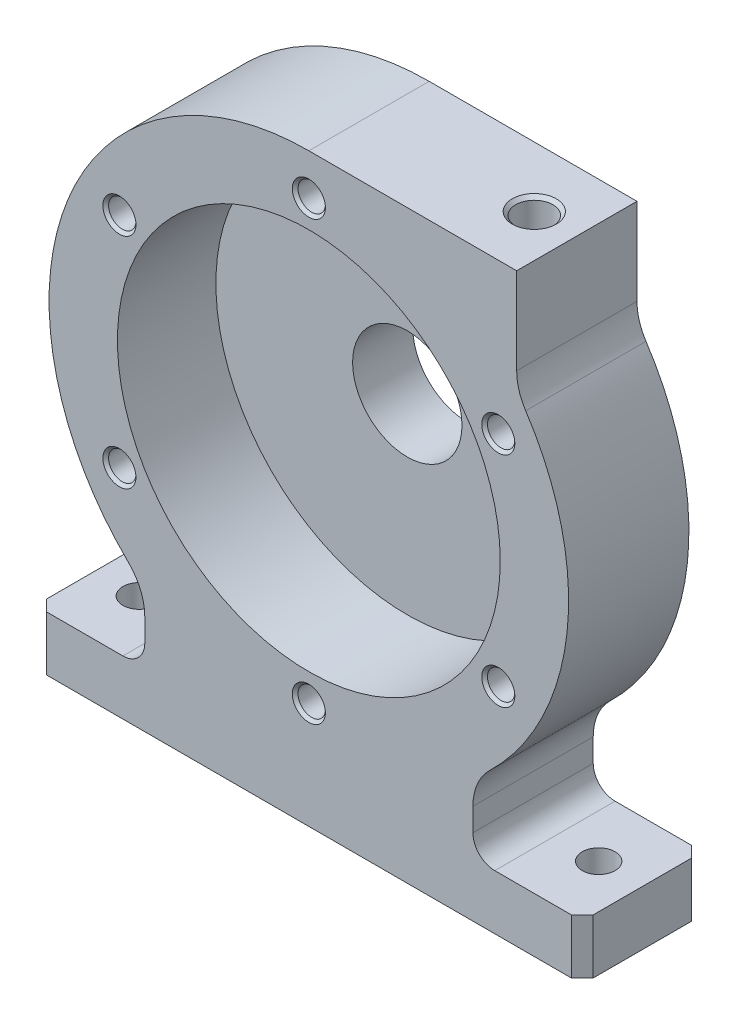
from build123d import *

# Parameters (mm, degrees)
BOSS_EXTRUDE1_DEPTH                                 = 22
SKETCH2_R                                           = 35
CUT_EXTRUDE1_DEPTH                                  = 18
SKETCH3_R                                           = 14
BOSS_EXTRUDE2_DEPTH                                 = 7
FILLET1_R                                           = 4
SKETCH4_R                                           = 10
CUT_EXTRUDE2_DEPTH                                  = 83.953300115
CHAMFER1_SIZE                                       = 2
M8X1_25_TAPPED_HOLE1_D                              = 6.8
M8X1_25_TAPPED_HOLE1_DEPTH                          = 29.75
M8X1_25_TAPPED_HOLE1_CSINK_D                        = 8.05
M8X1_25_TAPPED_HOLE1_CSINK_ANGLE                    = 90
M8X1_25_TAPPED_HOLE1_TIP                            = 2.042926105
CIRPATTERN1_COUNT                                   = 6
CSK_FOR_M8_COUNTERSUNK_FLAT_HEAD_SCREW1_D           = 6
CSK_FOR_M8_COUNTERSUNK_FLAT_HEAD_SCREW1_DEPTH       = 20
CSK_FOR_M8_COUNTERSUNK_FLAT_HEAD_SCREW1_CSINK_D     = 8
CSK_FOR_M8_COUNTERSUNK_FLAT_HEAD_SCREW1_CSINK_ANGLE = 90
CSK_FOR_M8_COUNTERSUNK_FLAT_HEAD_SCREW1_TIP         = 1.802581857


with BuildPart() as part:
    # Sketch1 → Boss-Extrude1 (new body)
    with BuildSketch(Plane.XY):
        with BuildLine():
            Line((-50, -59.5), (50, -59.5))
            Line((50, -59.5), (50, -49.5))
            Line((50, -49.5), (34, -49.5))
            ThreePointArc((34, -49.5), (31.171572875, -48.328427125), (30, -45.5))
            Line((30, -45.5), (30, -41.306779105))
            ThreePointArc((30, -41.306779105), (30.792252789, -37.405831617), (33.043478261, -34.122991434))
            ThreePointArc((33.043478261, -34.122991434), (47.217043986, -5.176944775), (39.652173913, 26.152535326))
            ThreePointArc((39.652173913, 26.152535326), (38.421945373, 28.784159388), (38, 31.658332237))
            Line((38, 31.658332237), (38, 47.5))
            Line((38, 47.5), (0, 47.5))
            ThreePointArc((0, 47.5), (-44.028922841, 17.824251834), (-33.043478261, -34.122991434))
            ThreePointArc((-33.043478261, -34.122991434), (-30.792252789, -37.405831617), (-30, -41.306779105))
            Line((-30, -41.306779105), (-30, -45.5))
            ThreePointArc((-30, -45.5), (-31.171572875, -48.328427125), (-34, -49.5))
            Line((-34, -49.5), (-50, -49.5))
            Line((-50, -49.5), (-50, -59.5))
        make_face()
    extrude(amount=BOSS_EXTRUDE1_DEPTH)

    # Sketch2 → Cut-Extrude1 (cut)
    with BuildSketch(Plane.XY.offset(22)):
        Circle(SKETCH2_R)
    extrude(amount=-CUT_EXTRUDE1_DEPTH, mode=Mode.SUBTRACT)

    # Sketch3 → Boss-Extrude2 (add)
    with BuildSketch(Plane(origin=(0, 0, 0), x_dir=(-1, 0, 0), z_dir=(0, 0, -1))):
        Circle(SKETCH3_R)
    extrude(amount=BOSS_EXTRUDE2_DEPTH)

    # Fillet1
    fillet1_edges = [part.edges().sort_by_distance(p)[0] for p in [
        (14, 0, 0),
    ]]
    fillet(fillet1_edges, radius=FILLET1_R)

    # Sketch4 → Cut-Extrude2 (cut, through all)
    with BuildSketch(Plane(origin=(0, 0, -7), x_dir=(-1, 0, 0), z_dir=(0, 0, -1))):
        Circle(SKETCH4_R)
    extrude(amount=-CUT_EXTRUDE2_DEPTH, mode=Mode.SUBTRACT)

    # Chamfer1
    chamfer1_edges = [part.edges().sort_by_distance(p)[0] for p in [
        (-50, -54.5, 0),
        (-50, -54.5, 22),
        (50, -54.5, 0),
        (50, -54.5, 22),
    ]]
    chamfer(chamfer1_edges, length=CHAMFER1_SIZE)

    # M8x1.25 Tapped Hole1
    with Locations(Plane(origin=(0, 47.5, 0), x_dir=(1, 0, 0), z_dir=(0, 1, 0))):
        with Locations((30.22415, -11)):
            CounterSinkHole(M8X1_25_TAPPED_HOLE1_D / 2, M8X1_25_TAPPED_HOLE1_CSINK_D / 2, depth=M8X1_25_TAPPED_HOLE1_DEPTH, counter_sink_angle=M8X1_25_TAPPED_HOLE1_CSINK_ANGLE)
            with Locations((0, 0, -(M8X1_25_TAPPED_HOLE1_DEPTH + M8X1_25_TAPPED_HOLE1_TIP / 2))):  # 118° drill point
                Cone(0, M8X1_25_TAPPED_HOLE1_D / 2, M8X1_25_TAPPED_HOLE1_TIP, mode=Mode.SUBTRACT)

    # Sketch10 → M6x1.0 Tapped Hole1 (revolve, cut)
    with BuildSketch(Plane(origin=(0, 40, 22), x_dir=(0, -1, 0), z_dir=(1, 0, 0))):
        Polygon((0, 0), (0, 16.502151548), (2.5, 15), (2.5, 0.525), (3.025, 0), align=None)
    m6x1_0_tapped_hole1 = revolve(axis=Axis((0, 40, 28.35), (0, 0, -1)), mode=Mode.SUBTRACT)

    # CirPattern1: M6x1.0 Tapped Hole1 ×6 about axis
    cirpattern1_axis = Axis((0, 0, 22), (0, 0, -1))
    for i in range(1, CIRPATTERN1_COUNT):
        add(m6x1_0_tapped_hole1.rotate(cirpattern1_axis, i * 360 / CIRPATTERN1_COUNT), mode=Mode.SUBTRACT)

    # CSK for M8 Countersunk Flat Head Screw1
    with Locations(Plane(origin=(0, -59.5, 0), x_dir=(-1, 0, 0), z_dir=(0, -1, 0))):
        with Locations((42, -11), (-42, -11)):
            CounterSinkHole(CSK_FOR_M8_COUNTERSUNK_FLAT_HEAD_SCREW1_D / 2, CSK_FOR_M8_COUNTERSUNK_FLAT_HEAD_SCREW1_CSINK_D / 2, depth=CSK_FOR_M8_COUNTERSUNK_FLAT_HEAD_SCREW1_DEPTH, counter_sink_angle=CSK_FOR_M8_COUNTERSUNK_FLAT_HEAD_SCREW1_CSINK_ANGLE)
            with Locations((0, 0, -(CSK_FOR_M8_COUNTERSUNK_FLAT_HEAD_SCREW1_DEPTH + CSK_FOR_M8_COUNTERSUNK_FLAT_HEAD_SCREW1_TIP / 2))):  # 118° drill point
                Cone(0, CSK_FOR_M8_COUNTERSUNK_FLAT_HEAD_SCREW1_D / 2, CSK_FOR_M8_COUNTERSUNK_FLAT_HEAD_SCREW1_TIP, mode=Mode.SUBTRACT)


solid = part.part
